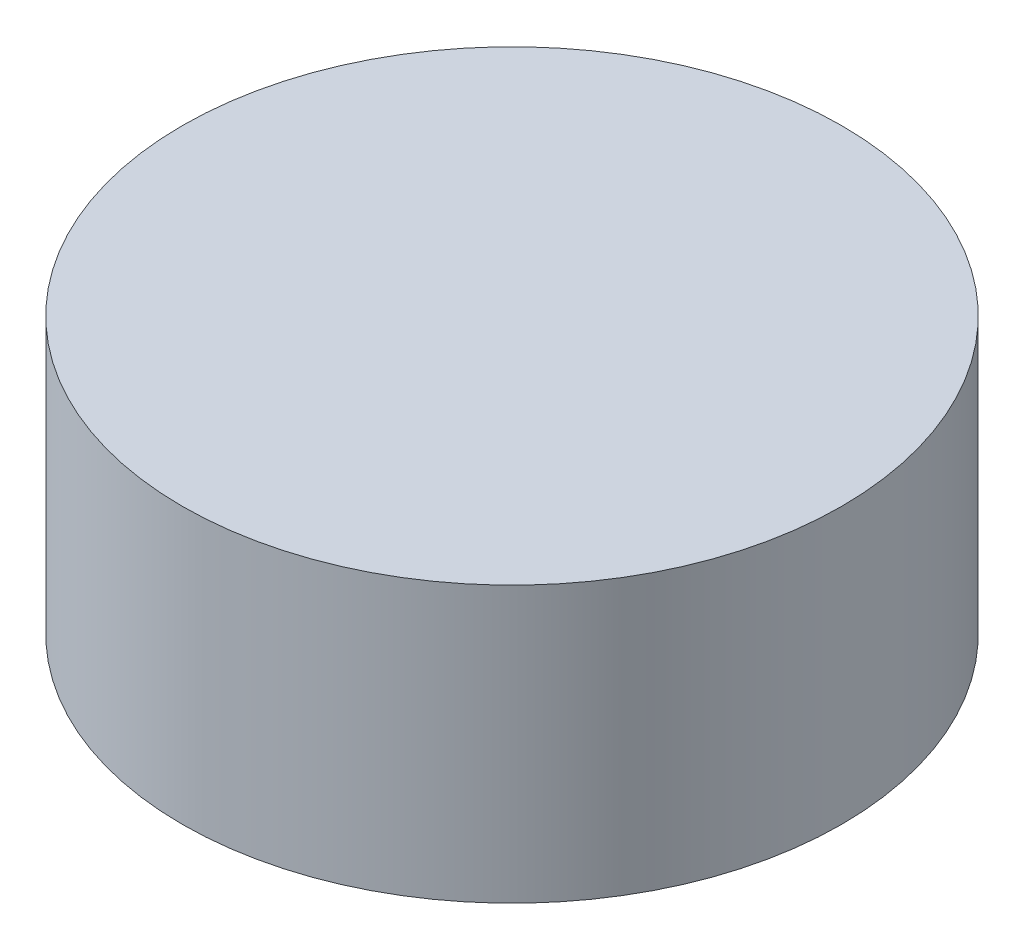
from build123d import *

# Parameters (mm, degrees)
SKETCH4_W = 4.883435582
SKETCH4_H = 4.08


with BuildPart() as part:
    # Sketch4 → Revolve1 (revolve)
    with BuildSketch(Plane.XY):
        with Locations((5.616054949, 0.009321051)):
            Rectangle(SKETCH4_W, SKETCH4_H)
    revolve(axis=Axis((3.174337158, 2.049321051, 0), (0, -1, 0)))


solid = part.part
